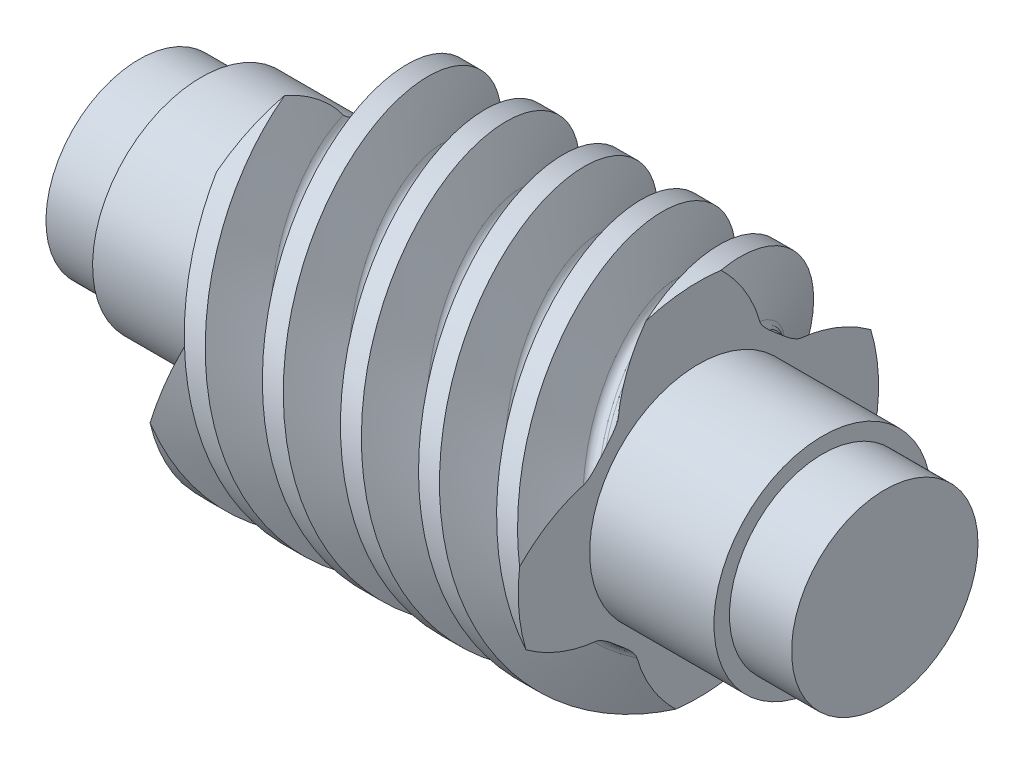
from build123d import *

# Parameters (mm, degrees)
SKETCH_1_W               = 24.48
SKETCH_1_H               = 11.6
SWEEP_1_PITCH            = 20.106192983
PATTERN_CIRCULAR_1_COUNT = 4
SKETCH_4_R               = 8
EXTRUDE_1_DEPTH          = 12.24
EXTRUDE_START            = 12.24
SKETCH_5_R               = 8
EXTRUDE_2_DEPTH          = 12.24
CUT_EXTRUDE_1_DEPTH      = 30
CUT_EXTRUDE_2_DEPTH      = 41.217886791
CUT_EXTRUDE_2_DEPTH_BACK = 41.217886791
SKETCH_8_OUTSIDE_W       = 62.748
SKETCH_8_OUTSIDE_H       = 36.988
SKETCH_8_OUTSIDE_W_2     = 48
SKETCH_8_OUTSIDE_H_2     = 26.712858453
SKETCH_9_R               = 9.42231853
SKETCH_9_R_2             = 6
CUT_EXTRUDE_4_DEPTH      = 4
SKETCH_10_R              = 13.107684575
SKETCH_10_R_2            = 7
CUT_EXTRUDE_5_DEPTH      = 8
CUT_EXTRUDE_START        = -4
SKETCH_11_R              = 7
SKETCH_11_R_2            = 6
CUT_EXTRUDE_6_DEPTH      = 4
CUT_EXTRUDE_START_2      = -12
SKETCH_12_R              = 13.747980369
SKETCH_12_R_2            = 7
CUT_EXTRUDE_7_DEPTH      = 12


with BuildPart() as part:
    # 草图1 → 旋转1 (revolve)
    with BuildSketch(Plane.XY, mode=Mode.PRIVATE) as revolve_1_sk:
        with Locations((12.24, 5.8)):
            Rectangle(SKETCH_1_W, SKETCH_1_H)
    revolve(revolve_1_sk.sketch.rotate(Axis((-56.849408284, 0, 0), (1, 0, 0)), 90), axis=Axis((-56.849408284, 0, 0), (1, 0, 0)))

    # 切除-扫描1: the profile of 草图3 profile screwed along a right-hand helix of 2.435071 turns, 20 arcs to a turn; built about Z, then put on its axis
    sweep_1_z = Axis((0, 0, 0), (0, 0, 1))
    sweep_1_corners = [(11.6003, 0, -5.5170775), (11.6003, 0, -1.838880245), (8.400051753, 0, -3.003675349), (8, 0, -3.575008463), (8, 0, -3.780949282), (8.400051753, 0, -4.352282396)]
    with BuildLine(mode=Mode.PRIVATE) as sweep_1_profile:
        Line(sweep_1_corners[0], sweep_1_corners[1])
        Line(sweep_1_corners[1], sweep_1_corners[2])
        Line(sweep_1_corners[3], sweep_1_corners[4])
        Line(sweep_1_corners[5], sweep_1_corners[0])
        ThreePointArc((8.400051753, 0, -3.003675349), (8.109955557, 0, -3.22627399), (8, 0, -3.575008463))
        ThreePointArc((8, 0, -3.780949282), (8.109955557, 0, -4.129683755), (8.400051753, 0, -4.352282396))
    sweep_1_cap = Face(sweep_1_profile.wire())
    sweep_1_arcs = [((8.400051753, 0, -3.003675349), (8, 0, -3.14928228), (8, 0, -3.575008463), (1, 0.8191520442889872, 1)), ((8, 0, -3.780949282), (8, 0, -4.206675465), (8.400051753, 0, -4.352282396), (1, 0.8191520442889924, 1))]  # start, shoulder, end, weights
    sweep_1_turn_angles = [0, 9, 18, 27, 36, 45, 54, 63, 72, 81, 90, 99, 108, 117, 126, 135, 144, 153, 162, 171, 180, 189, 198, 207, 216, 225, 234, 243, 252, 261, 270, 279, 288, 297, 306, 315, 324, 333, 342, 351, 360]
    sweep_1_turn_weights = [1, 0.9876883405951378, 1, 0.9876883405951378, 1, 0.9876883405951378, 1, 0.9876883405951378, 1, 0.9876883405951378, 1, 0.9876883405951378, 1, 0.9876883405951378, 1, 0.9876883405951378, 1, 0.9876883405951378, 1, 0.9876883405951378, 1, 0.9876883405951378, 1, 0.9876883405951378, 1, 0.9876883405951378, 1, 0.9876883405951378, 1, 0.9876883405951378, 1, 0.9876883405951378, 1, 0.9876883405951378, 1, 0.9876883405951378, 1, 0.9876883405951378, 1, 0.9876883405951378, 1]
    sweep_1_turn_rails = [Edge.make_bspline([Vector(p[0], p[1], 0).rotate(sweep_1_z, sweep_1_turn_angles[k]) / sweep_1_turn_weights[k] + Vector(0, 0, p[2] + SWEEP_1_PITCH * sweep_1_turn_angles[k] / 360) for k in range(41)], [0, 0, 0, 1, 1, 2, 2, 3, 3, 4, 4, 5, 5, 6, 6, 7, 7, 8, 8, 9, 9, 10, 10, 11, 11, 12, 12, 13, 13, 14, 14, 15, 15, 16, 16, 17, 17, 18, 18, 19, 19, 20, 20, 20], 2, sweep_1_turn_weights) for p in sweep_1_corners]
    sweep_1_turn_sides = [*[Face.make_surface_from_curves(sweep_1_turn_rails[p[0]], sweep_1_turn_rails[p[1]]) for p in [(0, 1), (1, 2), (3, 4), (5, 0)]], *[Face.make_bezier_surface([[Vector(p[j][0], p[j][1], 0).rotate(sweep_1_z, sweep_1_turn_angles[2 * i + k]) / sweep_1_turn_weights[2 * i + k] + Vector(0, 0, p[j][2] + SWEEP_1_PITCH * sweep_1_turn_angles[2 * i + k] / 360) for k in range(3)] for j in range(3)], [[p[3][j] * sweep_1_turn_weights[2 * i + k] for k in range(3)] for j in range(3)]) for p in sweep_1_arcs for i in range(20)]]
    sweep_1_last_angles = [720, 729, 738, 747, 756, 765, 774, 783, 792, 801, 810, 819, 828, 837, 846, 855, 864, 870.312713275, 876.62542655]
    sweep_1_last_weights = [1, 0.9876883405951378, 1, 0.9876883405951378, 1, 0.9876883405951378, 1, 0.9876883405951378, 1, 0.9876883405951378, 1, 0.9876883405951378, 1, 0.9876883405951378, 1, 0.9876883405951378, 1, 0.9939365822041291, 1]
    sweep_1_last_rails = [Edge.make_bspline([Vector(p[0], p[1], 0).rotate(sweep_1_z, sweep_1_last_angles[k]) / sweep_1_last_weights[k] + Vector(0, 0, p[2] + SWEEP_1_PITCH * sweep_1_last_angles[k] / 360) for k in range(19)], [0, 0, 0, 1, 1, 2, 2, 3, 3, 4, 4, 5, 5, 6, 6, 7, 7, 8, 8, 9, 9, 9], 2, sweep_1_last_weights) for p in sweep_1_corners]
    sweep_1_last_sides = [*[Face.make_surface_from_curves(sweep_1_last_rails[p[0]], sweep_1_last_rails[p[1]]) for p in [(0, 1), (1, 2), (3, 4), (5, 0)]], *[Face.make_bezier_surface([[Vector(p[j][0], p[j][1], 0).rotate(sweep_1_z, sweep_1_last_angles[2 * i + k]) / sweep_1_last_weights[2 * i + k] + Vector(0, 0, p[j][2] + SWEEP_1_PITCH * sweep_1_last_angles[2 * i + k] / 360) for k in range(3)] for j in range(3)], [[p[3][j] * sweep_1_last_weights[2 * i + k] for k in range(3)] for j in range(3)]) for p in sweep_1_arcs for i in range(9)]]
    sweep_1 = Plane(origin=(0, 0, 0), x_dir=(0, 1, 0), z_dir=(1, 0, 0)) * Solid(Shell([*[p.moved(Location((0, 0, SWEEP_1_PITCH * i))) for i in range(2) for p in sweep_1_turn_sides], *sweep_1_last_sides, sweep_1_cap, sweep_1_cap.rotate(sweep_1_z, 876.62542655).moved(Location((0, 0, SWEEP_1_PITCH * 876.62542655 / 360)))]))
    add(sweep_1, mode=Mode.SUBTRACT)

    # 阵列(圆周)1: 切除-扫描1 ×4 about axis
    pattern_circular_1_axis = Axis((-10.963776132, 0, 0), (1, 0, 0))
    for i in range(1, PATTERN_CIRCULAR_1_COUNT):
        add(sweep_1.rotate(pattern_circular_1_axis, i * 360 / PATTERN_CIRCULAR_1_COUNT), mode=Mode.SUBTRACT)

    # 草图4 → 凸台-拉伸1 (add)
    with BuildSketch(Plane(origin=(0, 0, 0), x_dir=(0, 0, -1), z_dir=(1, 0, 0))):
        Circle(SKETCH_4_R)
    extrude(amount=-EXTRUDE_1_DEPTH)

    # 草图5 → 凸台-拉伸2 (add)
    with BuildSketch(Plane(origin=(24.48, 0, 0), x_dir=(0, 0, -1), z_dir=(1, 0, 0)).offset(EXTRUDE_START)):
        Circle(SKETCH_5_R)
    extrude(amount=-EXTRUDE_2_DEPTH)

    # 草图6 → 切除-拉伸1 (cut)
    with BuildSketch(Plane.ZY.offset(12.24)):
        with BuildLine():
            Line((-1.532970972, 2.1), (1.532970972, 2.1))
            ThreePointArc((1.532970972, 2.1), (0, -2.6), (-1.532970972, 2.1))
        make_face()
    extrude(amount=-CUT_EXTRUDE_1_DEPTH, mode=Mode.SUBTRACT)

    # 草图8 outside → 切除-拉伸2 (cut, two sides: drawn at the far end of the back side and taken through both)
    with BuildSketch(Plane.XY.offset(-CUT_EXTRUDE_2_DEPTH_BACK)):
        with Locations((12.24, 0)):
            Rectangle(SKETCH_8_OUTSIDE_W, SKETCH_8_OUTSIDE_H)
        with Locations((12.24, -1.098095692)):
            Rectangle(SKETCH_8_OUTSIDE_W_2, SKETCH_8_OUTSIDE_H_2, mode=Mode.SUBTRACT)
    extrude(amount=CUT_EXTRUDE_2_DEPTH + CUT_EXTRUDE_2_DEPTH_BACK, mode=Mode.SUBTRACT)

    # 草图9 → 切除-拉伸4 (cut)
    with BuildSketch(Plane(origin=(36.24, 0, 0), x_dir=(0, 0, -1), z_dir=(1, 0, 0))):
        Circle(SKETCH_9_R)
        Circle(SKETCH_9_R_2, mode=Mode.SUBTRACT)
    extrude(amount=-CUT_EXTRUDE_4_DEPTH, mode=Mode.SUBTRACT)

    # 草图10 → 切除-拉伸5 (cut)
    with BuildSketch(Plane(origin=(32.24, 0, 0), x_dir=(0, 0, -1), z_dir=(1, 0, 0))):
        Circle(SKETCH_10_R)
        Circle(SKETCH_10_R_2, mode=Mode.SUBTRACT)
    extrude(amount=-CUT_EXTRUDE_5_DEPTH, mode=Mode.SUBTRACT)

    # 草图11 → 切除-拉伸6 (cut)
    with BuildSketch(Plane.ZY.offset(11.76).offset(CUT_EXTRUDE_START)):
        with Locations(Location((0, 0, 0), (0, 0, 180))):
            Circle(SKETCH_11_R)
        with Locations(Location((0, 0, 0), (0, 0, 180))):
            Circle(SKETCH_11_R_2, mode=Mode.SUBTRACT)
    extrude(amount=CUT_EXTRUDE_6_DEPTH, mode=Mode.SUBTRACT)

    # 草图12 → 切除-拉伸7 (cut)
    with BuildSketch(Plane.ZY.offset(11.76).offset(CUT_EXTRUDE_START_2)):
        Circle(SKETCH_12_R)
        with Locations(Location((0, 0, 0), (0, 0, 180))):
            Circle(SKETCH_12_R_2, mode=Mode.SUBTRACT)
    extrude(amount=CUT_EXTRUDE_7_DEPTH, mode=Mode.SUBTRACT)


solid = part.part
